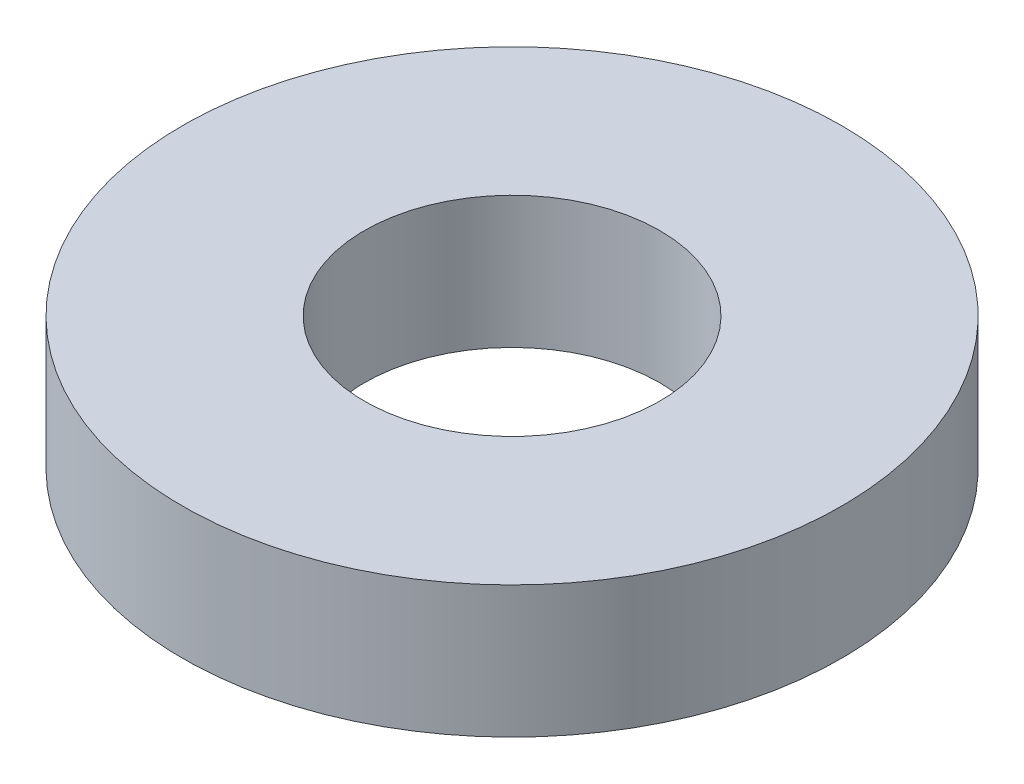
from build123d import *

# Parameters (mm, degrees)
SKETCH1_R           = 72.5
BOSS_EXTRUDE1_DEPTH = 29
SKETCH2_R           = 32.5
CUT_EXTRUDE1_DEPTH  = 107.552803811


with BuildPart() as part:
    # Sketch1 → Boss-Extrude1 (new body)
    with BuildSketch(Plane(origin=(0, 0, 0), x_dir=(1, 0, 0), z_dir=(0, 1, 0))):
        Circle(SKETCH1_R)
    extrude(amount=BOSS_EXTRUDE1_DEPTH)

    # Sketch2 → Cut-Extrude1 (cut, through all)
    with BuildSketch(Plane(origin=(0, 0, 0), x_dir=(1, 0, 0), z_dir=(0, 1, 0))):
        Circle(SKETCH2_R)
    extrude(amount=CUT_EXTRUDE1_DEPTH, mode=Mode.SUBTRACT)


solid = part.part
